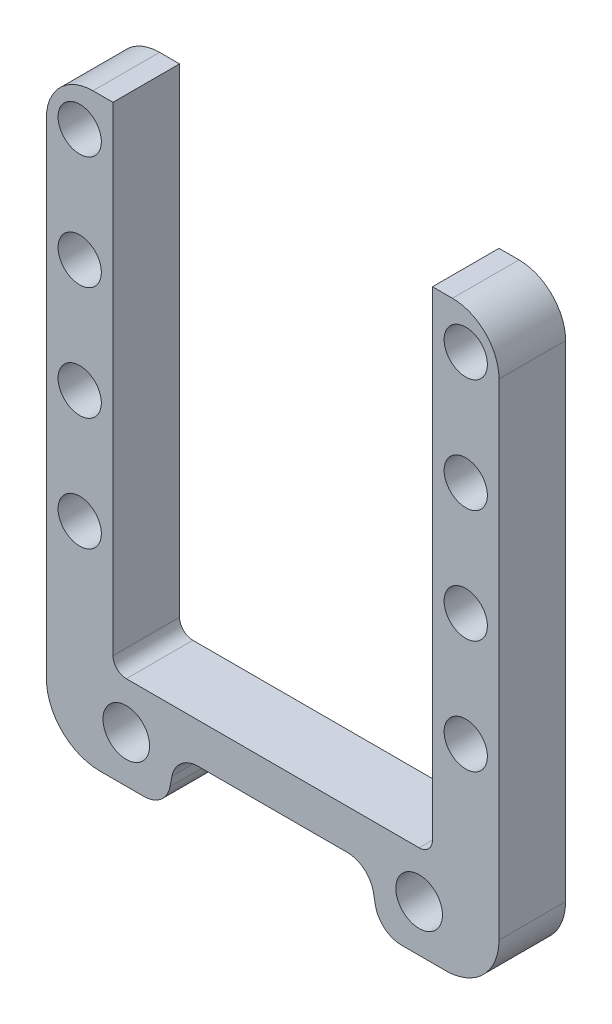
from build123d import *

# Parameters (mm, degrees)
ESQUISSE1_R        = 3.25
ESQUISSE1_R_2      = 3.5
BOSS_EXTRU_1_DEPTH = 10
CONG_1_R           = 4
CONG_2_R           = 8
CONG_3_R           = 7
CONG_4_R           = 2


with BuildPart() as part:
    # Esquisse1 → Boss.-Extru.1 (new body)
    with BuildSketch(Plane.XY):
        Polygon((24, 104), (24, 30), (0, 30), (0, 24), (14.5, 24), (16.055042473, 16), (34, 16), (34, 104), align=None)
        with Locations((29, 98)):
            Circle(ESQUISSE1_R, mode=Mode.SUBTRACT)
        with Locations((22, 23)):
            Circle(ESQUISSE1_R_2, mode=Mode.SUBTRACT)
        with Locations((29, 81)):
            Circle(ESQUISSE1_R, mode=Mode.SUBTRACT)
        with Locations((29, 64)):
            Circle(ESQUISSE1_R, mode=Mode.SUBTRACT)
        with Locations((29, 47)):
            Circle(ESQUISSE1_R, mode=Mode.SUBTRACT)
    boss_extru_1 = extrude(amount=BOSS_EXTRU_1_DEPTH)

    # Symétrie2: Boss.-Extru.1 across plane
    add(boss_extru_1.mirror(Plane(origin=(0, 30, 10), x_dir=(0, 0, 1), z_dir=(1, 0, 0))))

    # Congé1
    cong_1_edges = [part.edges().sort_by_distance(p)[0] for p in [
        (16.055042473, 16, 5),
        (-16.055042473, 16, 5),
        (-14.5, 24, 5),
        (14.5, 24, 5),
    ]]
    fillet(cong_1_edges, radius=CONG_1_R)

    # Congé2
    cong_2_edges = [part.edges().sort_by_distance(p)[0] for p in [
        (-34, 16, 5),
        (34, 16, 5),
    ]]
    fillet(cong_2_edges, radius=CONG_2_R)

    # Congé3
    cong_3_edges = [part.edges().sort_by_distance(p)[0] for p in [
        (34, 104, 5),
        (-34, 104, 5),
    ]]
    fillet(cong_3_edges, radius=CONG_3_R)

    # Congé4
    cong_4_edges = [part.edges().sort_by_distance(p)[0] for p in [
        (-24, 30, 5),
        (24, 30, 5),
    ]]
    fillet(cong_4_edges, radius=CONG_4_R)


solid = part.part
